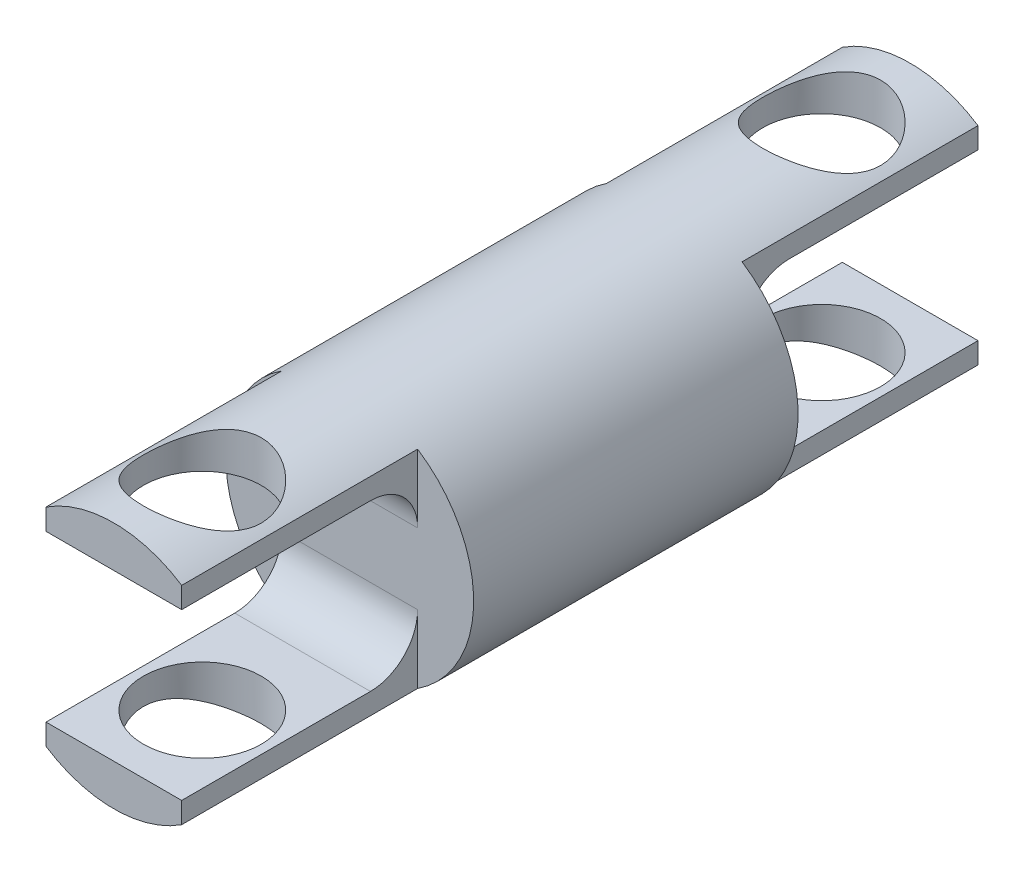
from build123d import *

# Parameters (mm, degrees)
SZKIC1_R                               = 21
DODANIE_WYCI_GNI_CIE1_DEPTH            = 27.5
DODANIE_WYCI_GNI_CIE4_DEPTH            = 40
SZKIC7_R                               = 10
WYTNIJ_WYCI_GNI_CIE1_DEPTH             = 40
WYTNIJ_WYCI_GNI_CIE1_DIRECTION_2_REACH = 80.881
ZAOKR_GLENIE1_R                        = 8
ZAOKR_GLENIE1_OF_LUSTRO2_R             = 8


with BuildPart() as part:
    # Szkic1 → Dodanie-wyciągnięcie1 (new body)
    with BuildSketch(Plane.XY):
        Circle(SZKIC1_R)
    dodanie_wyci_gni_cie1 = extrude(amount=DODANIE_WYCI_GNI_CIE1_DEPTH)

    # Szkic6 → Dodanie-wyciągnięcie4 (add)
    with BuildSketch(Plane.XY.offset(27.5)):
        with BuildLine():
            Line((-11.5, 17.571283391), (-11.5, 14))
            Line((-11.5, 14), (11.5, 14))
            Line((11.5, 14), (11.5, 17.571283391))
            ThreePointArc((11.5, 17.571283391), (0, 21), (-11.5, 17.571283391))
        make_face()
        with BuildLine():
            Line((11.5, -14), (11.5, -17.571283391))
            ThreePointArc((11.5, -17.571283391), (0, -21), (-11.5, -17.571283391))
            Line((-11.5, -17.571283391), (-11.5, -14))
            Line((-11.5, -14), (11.5, -14))
        make_face()
    dodanie_wyci_gni_cie4 = extrude(amount=DODANIE_WYCI_GNI_CIE4_DEPTH)

    # Szkic7 → Wytnij-wyciągnięcie1 (cut)
    with BuildSketch(Plane(origin=(0, -14, 0), x_dir=(1, 0, 0), z_dir=(0, 1, 0))):
        with Locations((0, -52.5)):
            Circle(SZKIC7_R)
    wytnij_wyci_gni_cie1 = extrude(amount=WYTNIJ_WYCI_GNI_CIE1_DEPTH, mode=Mode.SUBTRACT)

    # Szkic7 → Wytnij-wyciągnięcie1 direction 2 (cut, up to next)
    with BuildSketch(Plane(origin=(0, -14, 0), x_dir=(1, 0, 0), z_dir=(0, 1, 0)), mode=Mode.PRIVATE) as wytnij_wyci_gni_cie1_direction_2_sk1:
        with Locations((0, -52.5)):
            Circle(SZKIC7_R)
    wytnij_wyci_gni_cie1_direction_2_tool1 = extrude(wytnij_wyci_gni_cie1_direction_2_sk1.sketch, amount=-WYTNIJ_WYCI_GNI_CIE1_DIRECTION_2_REACH, mode=Mode.PRIVATE) & part.part
    wytnij_wyci_gni_cie1_direction_2 = wytnij_wyci_gni_cie1_direction_2_tool1.solids().sort_by_distance((0, -14, 52.5))[0]
    add(wytnij_wyci_gni_cie1_direction_2, mode=Mode.SUBTRACT)

    # Zaokrąglenie1
    zaokr_glenie1_edges = [part.edges().sort_by_distance(p)[0] for p in [
        (0, -14, 27.5),
        (0, 14, 27.5),
    ]]
    fillet(zaokr_glenie1_edges, radius=ZAOKR_GLENIE1_R)

    # Lustro2: Dodanie-wyciągnięcie1, Dodanie-wyciągnięcie4, Wytnij-wyciągnięcie1, Wytnij-wyciągnięcie1 direction 2 across plane
    add(dodanie_wyci_gni_cie1.mirror(Plane.XY))
    add(dodanie_wyci_gni_cie4.mirror(Plane.XY))
    add(wytnij_wyci_gni_cie1.mirror(Plane.XY), mode=Mode.SUBTRACT)
    add(wytnij_wyci_gni_cie1_direction_2.mirror(Plane.XY), mode=Mode.SUBTRACT)

    # Zaokrąglenie1 of Lustro2
    zaokr_glenie1_of_lustro2_edges = [part.edges().sort_by_distance(p)[0] for p in [
        (0, -14, -27.5),
        (0, 14, -27.5),
    ]]
    fillet(zaokr_glenie1_of_lustro2_edges, radius=ZAOKR_GLENIE1_OF_LUSTRO2_R)


solid = part.part
